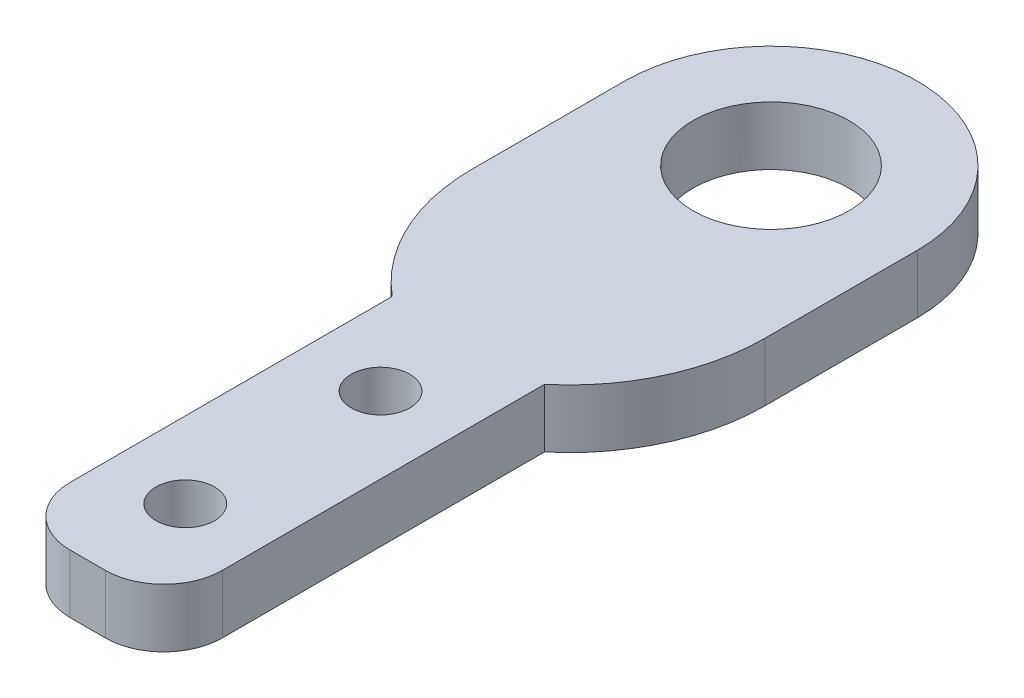
from build123d import *

# Parameters (mm, degrees)
EXTRUDE_1_DEPTH     = 3
SKETCH_2_R          = 4
CUT_EXTRUDE_1_DEPTH = 8
SKETCH_3_R          = 1.5
CUT_EXTRUDE_2_DEPTH = 3
CUT_EXTRUDE_3_DEPTH = 10
FILLET_1_R          = 10
SKETCH_5_W          = 7.8
SKETCH_5_H          = 20.5
CUT_EXTRUDE_4_DEPTH = 10
FILLET_3_R          = 3


with BuildPart() as part:
    # 草图1 → 凸台-拉伸1 (new body)
    with BuildSketch(Plane(origin=(0, 0, 0), x_dir=(1, 0, 0), z_dir=(0, 1, 0))):
        with BuildLine():
            Line((-7.5, -29), (7.5, -29))
            Line((7.5, -29), (7.5, 29))
            ThreePointArc((7.5, 29), (0, 36.5), (-7.5, 29))
            Line((-7.5, 29), (-7.5, -29))
        make_face()
    extrude(amount=EXTRUDE_1_DEPTH)

    # 草图2 → 切除-拉伸1 (cut)
    with BuildSketch(Plane(origin=(0, 3, 0), x_dir=(1, 0, 0), z_dir=(0, 1, 0))):
        with Locations(Location((0, 29, 0), (0, 0, 270))):
            Circle(SKETCH_2_R)
    extrude(amount=-CUT_EXTRUDE_1_DEPTH, mode=Mode.SUBTRACT)

    # 草图3 → 切除-拉伸2 (cut)
    with BuildSketch(Plane.XZ):
        with Locations(Location((0, 1, 0), (0, 0, 270))):
            Circle(SKETCH_3_R)
        with Locations(Location((0, -9, 0), (0, 0, 270))):
            Circle(SKETCH_3_R)
    extrude(amount=-CUT_EXTRUDE_2_DEPTH, mode=Mode.SUBTRACT)

    # 草图4 → 切除-拉伸3 (cut)
    with BuildSketch(Plane.XZ):
        Polygon((-7.5, -13.5), (-3.9, -13.5), (-3.9, 26.5), (3.9, 26.5), (3.9, -13.5), (7.5, -13.5), (7.5, 29), (-7.5, 29), align=None)
    extrude(amount=-CUT_EXTRUDE_3_DEPTH, mode=Mode.SUBTRACT)

    # 圆角1
    # the kernel refuses this fillet: 10 mm, written as the material it takes off along each edge
    with BuildSketch(Plane(origin=(7.5, -19.209372712, -13.5), x_dir=(0, 0, -1), z_dir=(0, 1, 0))) as fillet_1_piece_1:
        with BuildLine():
            CenterArc((7.683749085, 10), FILLET_1_R, 219.7918195, 50.2081805)
            Line((0, 3.6), (-0.153674982, 3.472))
            ThreePointArc((-0.153674982, 3.472), (-0.2, 1.8), (-0.2, 0))
            Line((-0.2, 0), (0, -0.2))
            Line((0, -0.2), (7.683749085, -0.2))
            Line((7.683749085, -0.2), (7.683749085, 0))
        make_face()
    extrude(amount=41.418745425, mode=Mode.SUBTRACT)
    with BuildSketch(Plane(origin=(-7.5, -19.209372712, -13.5), x_dir=(0, 0, -1), z_dir=(0, 1, 0))) as fillet_1_piece_2:
        with BuildLine():
            CenterArc((7.683749085, -10), FILLET_1_R, 90, 50.2081805)
            Line((0, -3.6), (-0.153674982, -3.472))
            ThreePointArc((-0.153674982, -3.472), (-0.2, -1.8), (-0.2, 0))
            Line((-0.2, 0), (0, 0.2))
            Line((0, 0.2), (7.683749085, 0.2))
            Line((7.683749085, 0.2), (7.683749085, 0))
        make_face()
    extrude(amount=41.418745425, mode=Mode.SUBTRACT)

    # 草图5 → 切除-拉伸4 (cut)
    with BuildSketch(Plane(origin=(0, 3, 0), x_dir=(1, 0, 0), z_dir=(0, 1, 0))):
        with Locations((0, -16.25)):
            Rectangle(SKETCH_5_W, SKETCH_5_H)
    extrude(amount=-CUT_EXTRUDE_4_DEPTH, mode=Mode.SUBTRACT)

    # 圆角3
    fillet_3_edges = [part.edges().sort_by_distance(p)[0] for p in [
        (-3.9, 1.5, 6),
        (3.9, 1.5, 6),
    ]]
    fillet(fillet_3_edges, radius=FILLET_3_R)


solid = part.part
